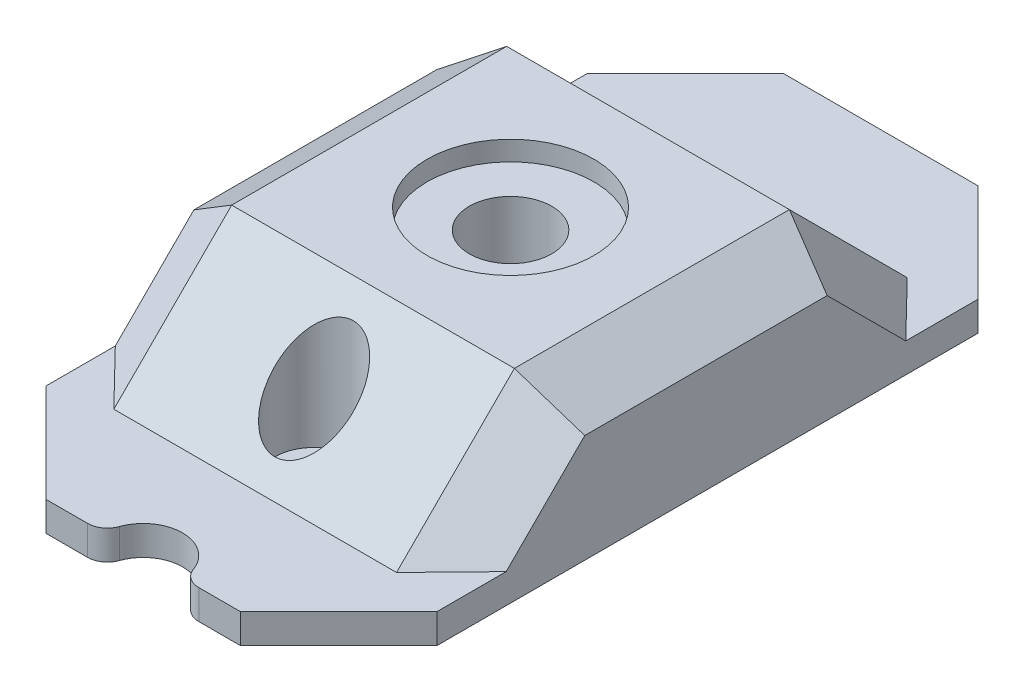
from build123d import *
from OCP.BRepFilletAPI import BRepFilletAPI_MakeChamfer

# Parameters (mm, degrees)
SKETCH1_W           = 12.900022784
SKETCH1_H           = 55.1
SKETCH1_R           = 1.7
SKETCH1_W_2         = 6.899977216
BOSS_EXTRUDE1_DEPTH = 6
SKETCH2_R           = 2.1
BOSS_EXTRUDE2_DEPTH = 3
CHAMFER2_SIZE2      = 3
CHAMFER2_SIZE       = 3.575260778
SKETCH3_W           = 39.8
SKETCH3_H           = 24
BOSS_EXTRUDE3_DEPTH = 12
SKETCH5_R           = 4.2
CUT_EXTRUDE2_DEPTH  = 34
SKETCH7_R           = 4
CUT_EXTRUDE4_DEPTH  = 2
SKETCH10_R          = 4
CUT_EXTRUDE5_DEPTH  = 6
FILLET2_R           = 2
CUT_EXTRUDE6_DEPTH  = 5.4
CHAMFER3_SIZE       = 14
CHAMFER4_SIZE       = 4
CHAMFER4_SIZE2      = 5.505527682
SKETCH12_R          = 8.5
CUT_EXTRUDE7_DEPTH  = 2


# Some blends are built 0.0001 mm under size
with BuildPart() as part:
    # Sketch1 → Boss-Extrude1 (new body)
    # profile 1 of 2: a face of its own
    with BuildSketch(Plane.XZ.offset(561.298939869)):
        with Locations((-177.760855006, 568.270141885)):
            Rectangle(SKETCH1_W, SKETCH1_H)
        with Locations((-181.210843614, 548.420141885)):
            Circle(SKETCH1_R, mode=Mode.SUBTRACT)
        with Locations((-181.210843614, 588.420141885)):
            Circle(SKETCH1_R, mode=Mode.SUBTRACT)
    # profile 2 of 2: a face of its own
    with BuildSketch(Plane.XZ.offset(561.298939869)):
        with Locations((-187.660855006, 568.270141885)):
            Rectangle(SKETCH1_W_2, SKETCH1_H)
    extrude(amount=BOSS_EXTRUDE1_DEPTH)

    # Sketch2 → Boss-Extrude2 (add)
    with BuildSketch(Plane(origin=(0, -564.298939869, 0), x_dir=(1, 0, 0), z_dir=(0, 1, 0))):
        Polygon((-191.110843614, -530.720141885), (-171.310843614, -530.720141885), (-161.310843614, -540.720141885), (-161.310843614, -595.820141885), (-171.310843614, -605.820141885), (-191.110843614, -605.820141885), (-201.110843614, -595.820141885), (-201.110843614, -540.720141885), align=None)
        with Locations((-181.210843614, -548.420141885)):
            Circle(SKETCH2_R, mode=Mode.SUBTRACT)
        with Locations((-181.210843614, -588.420141885)):
            Circle(SKETCH2_R, mode=Mode.SUBTRACT)
    extrude(amount=BOSS_EXTRUDE2_DEPTH)

    # Chamfer2
    chamfer2_edges = [part.edges().sort_by_distance(p)[0] for p in [
        (-191.110843614, -567.298939869, 568.270141885),
    ]]
    chamfer2_side = [part.faces().sort_by_distance(p)[0] for p in [
        (-191.050843614, -567.298939869, 568.270141885),
    ]]
    chamfer(chamfer2_edges, length=CHAMFER2_SIZE - 0.0001, length2=CHAMFER2_SIZE2 - 0.0001, reference=chamfer2_side[0])  # a hair under: the kernel refuses the full size

    # Sketch3 → Boss-Extrude3 (add)
    with BuildSketch(Plane(origin=(0, -561.298939869, 0), x_dir=(1, 0, 0), z_dir=(0, 1, 0))):
        with Locations((-181.210843614, -568.420141885)):
            Rectangle(SKETCH3_W, SKETCH3_H)
    extrude(amount=BOSS_EXTRUDE3_DEPTH)

    # Sketch5 → Cut-Extrude2 (cut)
    with BuildSketch(Plane(origin=(0, -549.298939869, 0), x_dir=(1, 0, 0), z_dir=(0, 1, 0))):
        with Locations(Location((-181.210843614, -568.420141885, 0), (0, 0, 180))):
            Circle(SKETCH5_R)
    extrude(amount=-CUT_EXTRUDE2_DEPTH, mode=Mode.SUBTRACT)

    # Sketch7 → Cut-Extrude4 (cut)
    with BuildSketch(Plane(origin=(0, -561.298939869, 0), x_dir=(1, 0, 0), z_dir=(0, 1, 0))):
        with Locations(Location((-181.210843614, -548.420141885, 0), (0, 0, 180))):
            Circle(SKETCH7_R)
        with Locations(Location((-181.210843614, -588.420141885, 0), (0, 0, 180))):
            Circle(SKETCH7_R)
    extrude(amount=-CUT_EXTRUDE4_DEPTH, mode=Mode.SUBTRACT)

    # Sketch10 → Cut-Extrude5 (cut)
    with BuildSketch(Plane(origin=(0, -561.298939869, 0), x_dir=(1, 0, 0), z_dir=(0, 1, 0))):
        with Locations((-181.210843614, -605.820141885)):
            Circle(SKETCH10_R)
    extrude(amount=-CUT_EXTRUDE5_DEPTH, mode=Mode.SUBTRACT)

    # Fillet2
    fillet2_edges = [part.edges().sort_by_distance(p)[0] for p in [
        (-177.210843614, -562.798939869, 605.820141885),
        (-185.210843614, -562.798939869, 605.820141885),
    ]]
    fillet(fillet2_edges, radius=FILLET2_R)

    # Sketch11 → Cut-Extrude6 (cut)
    with BuildSketch(Plane.XZ.offset(567.298939869)):
        Polygon((-185.02135539, 575.020141885), (-188.831867167, 568.420141885), (-185.02135539, 561.820141885), (-177.400331837, 561.820141885), (-173.58982006, 568.420141885), (-177.400331837, 575.020141885), align=None)
    extrude(amount=-CUT_EXTRUDE6_DEPTH, mode=Mode.SUBTRACT)

    # Chamfer3
    # the kernel refuses this chamfer: 14 mm, written as the material it adds along each edge
    with BuildSketch(Plane(origin=(-161.310843614, -561.298939869, 580.420141885), x_dir=(0, -0.027495876610589963, 0.9996219169112966), z_dir=(-1, 0, 0))) as chamfer3_piece_1_section:
        Polygon((CHAMFER3_SIZE * 0.999621916911, CHAMFER3_SIZE * 0.0274958766106), (-CHAMFER3_SIZE * 0.0274958766106, CHAMFER3_SIZE * 0.999621916911), (0, 0), align=None)
    chamfer3_piece_1 = extrude(amount=39.8, mode=Mode.PRIVATE)
    chamfer3_piece_1 = chamfer3_piece_1 - Plane(origin=(-181.210843614, -559.739674618, 588.420141885), x_dir=(-1, 0, 0), z_dir=(0, 1, 0)) * Cylinder(4, 136, mode=Mode.PRIVATE)
    chamfer3_piece_1 = split(chamfer3_piece_1, bisect_by=Plane(origin=(-194.47751028, -549.298939869, 592.639373465), z_dir=(0, -1, 0)), keep=Keep.TOP, mode=Mode.PRIVATE)
    add(chamfer3_piece_1)
    with BuildSketch(Plane(origin=(-201.110843614, -561.298939869, 556.420141885), x_dir=(3.206917197373746e-15, 0.9996219169112968, 0.027495876610589966), z_dir=(1, 0, 0))) as chamfer3_piece_2_section:
        Polygon((CHAMFER3_SIZE * 0.999621916911, -CHAMFER3_SIZE * 0.0274958766106), (-CHAMFER3_SIZE * 0.0274958766106, -CHAMFER3_SIZE * 0.999621916911), (0, 0), align=None)
    chamfer3_piece_2 = extrude(amount=39.8, mode=Mode.PRIVATE)
    chamfer3_piece_2 = split(chamfer3_piece_2, bisect_by=Plane(origin=(-167.944176947, -549.298939869, 552.464896655), z_dir=(0, -1, 0)), keep=Keep.TOP, mode=Mode.PRIVATE)
    chamfer3_piece_2 = chamfer3_piece_2 - Plane(origin=(-181.210843614, -551.475687905, 548.420141885), x_dir=(-1, 0, 0), z_dir=(0, 1, 0)) * Cylinder(4, 136, mode=Mode.PRIVATE)
    add(chamfer3_piece_2)

    # Chamfer4: one chamfer whose edges measure the first distance from different faces: ONE call of the kernel's chamfer builder (chamfer() names one face for all edges)
    chamfer4_edges_1 = [part.edges().sort_by_distance(p)[0] for p in [
        (-161.310843614, -555.298939869, 588.420141885),
        (-161.310843614, -555.298939869, 548.420141885),
        (-161.310843614, -549.298939869, 568.420141885),
    ]]
    chamfer4_side_1 = [part.faces().sort_by_distance(p)[0] for p in [
        (-161.310843614, -557.666443356, 568.381717896),
    ]]
    chamfer4_edges_2 = [part.edges().sort_by_distance(p)[0] for p in [
        (-201.110843614, -555.298939869, 588.420141885),
        (-201.110843614, -555.298939869, 548.420141885),
        (-201.110843614, -549.298939869, 568.420141885),
    ]]
    chamfer4_side_2 = [part.faces().sort_by_distance(p)[0] for p in [
        (-201.110843614, -557.666443356, 568.381717896),
    ]]
    chamfer4 = BRepFilletAPI_MakeChamfer(part.part.solid().wrapped)
    for e in chamfer4_edges_1:
        chamfer4.Add(CHAMFER4_SIZE, CHAMFER4_SIZE2, e.wrapped, chamfer4_side_1[0].wrapped)  # the first distance lies on this face
    for e in chamfer4_edges_2:
        chamfer4.Add(CHAMFER4_SIZE, CHAMFER4_SIZE2, e.wrapped, chamfer4_side_2[0].wrapped)  # the first distance lies on this face
    add(Compound.cast(chamfer4.Shape()), mode=Mode.REPLACE)

    # Sketch12 → Cut-Extrude7 (cut)
    with BuildSketch(Plane(origin=(0, -549.298939869, 0), x_dir=(1, 0, 0), z_dir=(0, 1, 0))):
        with Locations(Location((-181.210843614, -568.420141885, 0), (0, 0, 180))):
            Circle(SKETCH12_R)
    extrude(amount=-CUT_EXTRUDE7_DEPTH, mode=Mode.SUBTRACT)


solid = part.part
